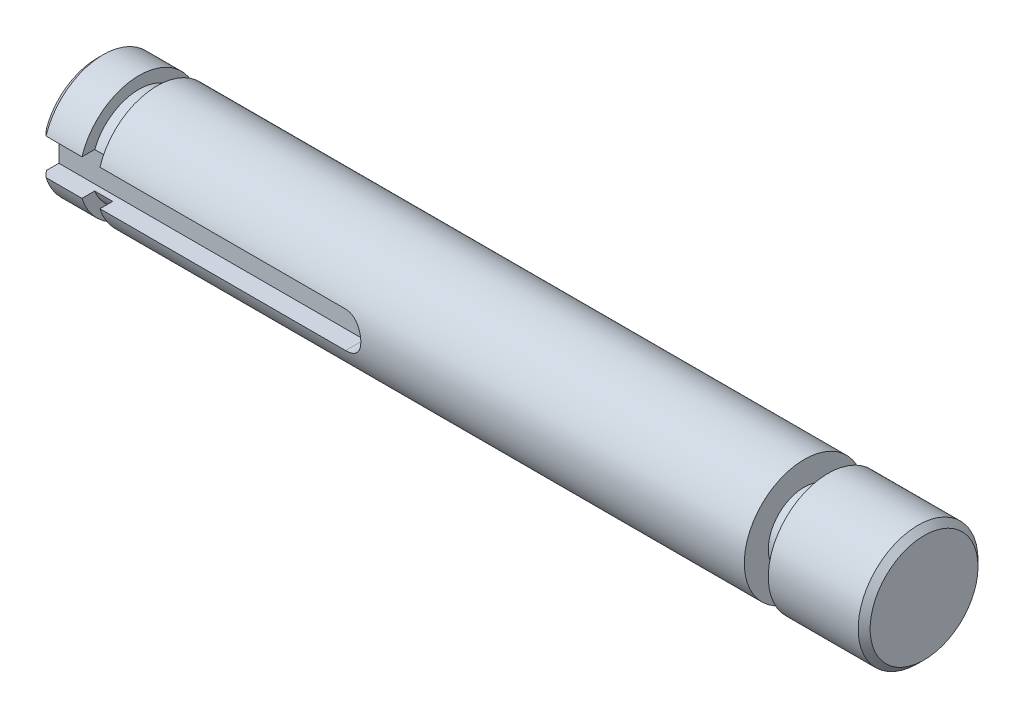
from build123d import *

# Parameters (mm, degrees)
SKETCH1_R           = 5
BOSS_EXTRUDE1_DEPTH = 34.5
CUT_EXTRUDE1_START  = -8
SKETCH2_R           = 5
SKETCH2_R_2         = 3
CUT_EXTRUDE1_DEPTH  = 2
CUT_EXTRUDE2_START  = -5
SKETCH3_R           = 5
SKETCH3_R_2         = 4
CUT_EXTRUDE2_DEPTH  = 1.5
CHAMFER1_SIZE       = 0.5
CUT_EXTRUDE3_START  = 3.2
CUT_EXTRUDE3_DEPTH  = 33.017183306


with BuildPart() as part:
    # Sketch1 → Boss-Extrude1 (new, symmetric)
    with BuildSketch(Plane(origin=(0, 0, 0), x_dir=(0, 0, -1), z_dir=(1, 0, 0))):
        Circle(SKETCH1_R)
    extrude(amount=BOSS_EXTRUDE1_DEPTH, both=True)

    # Sketch2 → Cut-Extrude1 (cut)
    with BuildSketch(Plane(origin=(34.5, 0, 0), x_dir=(0, 0, -1), z_dir=(1, 0, 0)).offset(CUT_EXTRUDE1_START)):
        Circle(SKETCH2_R)
        Circle(SKETCH2_R_2, mode=Mode.SUBTRACT)
    extrude(amount=-CUT_EXTRUDE1_DEPTH, mode=Mode.SUBTRACT)

    # Sketch3 → Cut-Extrude2 (cut)
    with BuildSketch(Plane.ZY.offset(34.5).offset(CUT_EXTRUDE2_START)):
        Circle(SKETCH3_R)
        Circle(SKETCH3_R_2, mode=Mode.SUBTRACT)
    extrude(amount=CUT_EXTRUDE2_DEPTH, mode=Mode.SUBTRACT)

    # Chamfer1
    chamfer1_edges = [part.edges().sort_by_distance(p)[0] for p in [
        (34.5, 0, 5),
        (-34.5, 0, 5),
    ]]
    chamfer(chamfer1_edges, length=CHAMFER1_SIZE)

    # Sketch4 → Cut-Extrude3 (cut, through all)
    with BuildSketch(Plane.XY.offset(CUT_EXTRUDE3_START)):
        with BuildLine():
            Line((-34.5, 1.5), (-9, 1.5))
            ThreePointArc((-9, 1.5), (-7.5, 0), (-9, -1.5))
            Line((-9, -1.5), (-34.5, -1.5))
            Line((-34.5, -1.5), (-34.5, 1.5))
        make_face()
    extrude(amount=CUT_EXTRUDE3_DEPTH, mode=Mode.SUBTRACT)


solid = part.part
